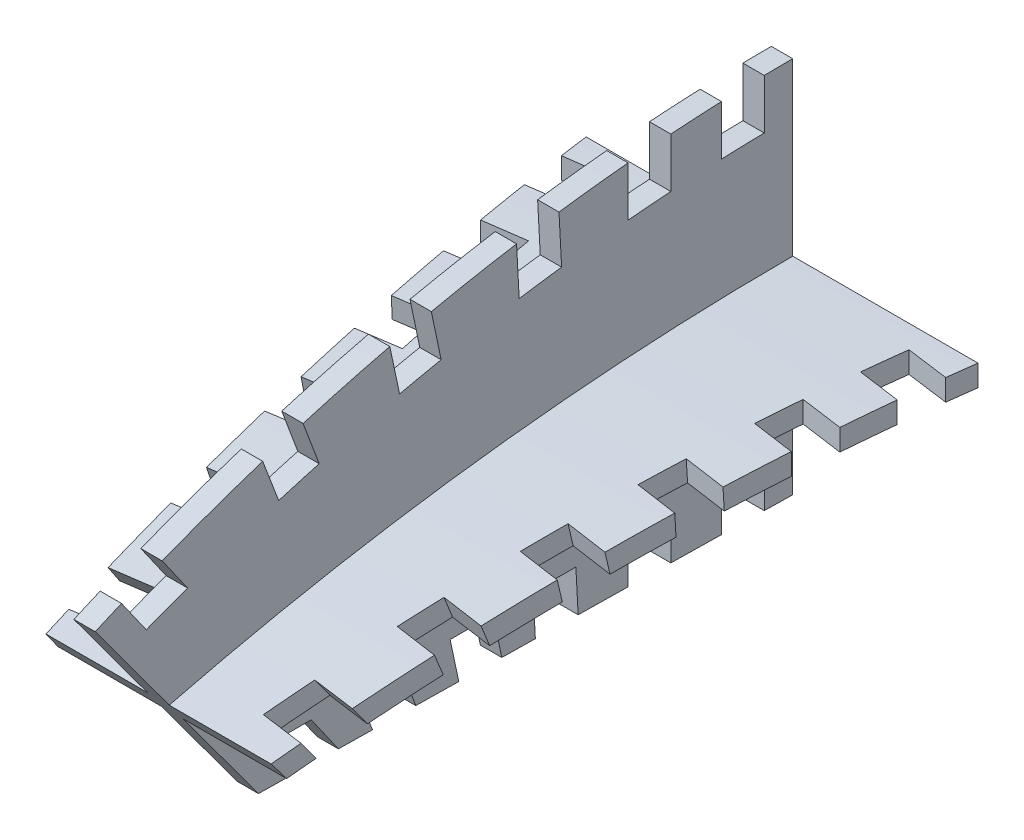
from build123d import *

# Parameters (mm, degrees)
CROQUIS4_OUTSIDE_W    = 187.146
CROQUIS4_OUTSIDE_H    = 118.564
CORTAR_EXTRUIR1_DEPTH = 80
CROQUIS6_OUTSIDE_W    = 81.834
CROQUIS6_OUTSIDE_H    = 124.727
CORTAR_EXTRUIR2_DEPTH = 160
CROQUIS7_W            = 6
CROQUIS7_H            = 11.530091944
CROQUIS7_H_2          = 11.150185128
CORTAR_EXTRUIR3_DEPTH = 80
CORTAR_EXTRUIR4_DEPTH = 6


with BuildPart() as part:
    # Barrer1: sweep along a path in Croquis1
    with BuildLine(Plane(origin=(0, 0, 0), x_dir=(0, 0, -1), z_dir=(1, 0, 0))) as barrer1_path:
        ThreePointArc((0, 0), (-70.78150519, -7.069828687), (-138.766305054, -27.999973026))
    # Croquis3 → Barrer1 (sweep)
    with BuildSketch(Plane.XY):
        Polygon((1.5, 1.5), (27.5, 1.5), (27.5, -1.5), (1.5, -1.5), (1.5, -27.5), (-1.5, -27.5), (-1.5, -1.5), (-27.5, -1.5), (-27.5, 1.5), (-1.5, 1.5), (-1.5, 27.5), (1.5, 27.5), align=None)
    sweep(path=barrer1_path.line)

    # Croquis4 outside → Cortar-Extruir1 (cut, symmetric)
    with BuildSketch(Plane(origin=(0, 0, 0), x_dir=(0, 0, -1), z_dir=(1, 0, 0))):
        with Locations((-74.715, -12.924)):
            Rectangle(CROQUIS4_OUTSIDE_W, CROQUIS4_OUTSIDE_H)
        with BuildLine():
            Line((0, -27.5), (-74.990890667, -26.331104364))
            Line((-74.990890667, -26.331104364), (-97.892548848, 4.795761137))
            ThreePointArc((-97.892548848, 4.795761137), (-50.029033138, 20.26731582), (0, 25.5))
            Line((0, 25.5), (0, -27.5))
        make_face(mode=Mode.SUBTRACT)
    extrude(amount=CORTAR_EXTRUIR1_DEPTH, both=True, mode=Mode.SUBTRACT)

    # Croquis6 outside → Cortar-Extruir2 (cut)
    with BuildSketch(Plane(origin=(0, 5.516683272, 0), x_dir=(1, 0, 0), z_dir=(0, 1, 0))):
        with Locations((0, -48.9465)):
            Rectangle(CROQUIS6_OUTSIDE_W, CROQUIS6_OUTSIDE_H)
        Polygon((-14, -100.938946435), (14, -100.938946435), (27.5, 0), (-27.5, 0), align=None, mode=Mode.SUBTRACT)
    extrude(amount=-CORTAR_EXTRUIR2_DEPTH, mode=Mode.SUBTRACT)

    # Croquis7 → Cortar-Extruir3 (cut, symmetric)
    with BuildSketch(Plane(origin=(0, 0, 0), x_dir=(0, 0, -1), z_dir=(1, 0, 0))):
        with BuildLine():
            Line((-39.162038985, 29.887130451), (-38.394773419, 15.534089498))
            ThreePointArc((-38.394773419, 15.534089498), (-35.420115181, 15.978111033), (-32.440330522, 16.386314579))
            Line((-32.440330522, 16.386314579), (-33.162038985, 29.887130451))
            Line((-33.162038985, 29.887130451), (-39.162038985, 29.887130451))
        make_face()
        with BuildLine():
            Line((-95.998773275, 8.949175928), (-90.73413022, 1.453466626))
            ThreePointArc((-90.73413022, 1.453466626), (-87.839590077, 2.560262358), (-84.931553052, 3.631093852))
            Line((-84.931553052, 3.631093852), (-91.088818329, 12.397703501))
            Line((-91.088818329, 12.397703501), (-95.998773275, 8.949175928))
        make_face()
        Polygon((-69.970419416, -28.109551905), (-62.557233475, -28.225082076), (-67.58991194, -21.059640015), (-74.921954778, -21.059640015), align=None)
        with BuildLine():
            Line((-23.107542671, 31.535166454), (-23.107542671, 17.429792254))
            ThreePointArc((-23.107542671, 17.429792254), (-20.109000001, 17.689943856), (-17.107542671, 17.913977122))
            Line((-17.107542671, 17.913977122), (-17.107542671, 31.535166454))
            Line((-17.107542671, 31.535166454), (-23.107542671, 31.535166454))
        make_face()
        with Locations((-20.107542671, -26.824685987)):
            Rectangle(CROQUIS7_W, CROQUIS7_H)
        with BuildLine():
            Line((-9.997867065, 30.351736416), (-9.997867065, 18.300005313))
            ThreePointArc((-9.997867065, 18.300005313), (-6.998371361, 18.402026399), (-3.997867065, 18.468032074))
            Line((-3.997867065, 18.468032074), (-3.997867065, 30.351736416))
            Line((-3.997867065, 30.351736416), (-9.997867065, 30.351736416))
        make_face()
        with Locations((-6.997867065, -26.634732579)):
            Rectangle(CROQUIS7_W, CROQUIS7_H_2)
        Polygon((-35.709124815, -34.705652912), (-29.709124815, -34.705652912), (-30.438595026, -21.059640015), (-36.438595026, -21.059640015), align=None)
        with BuildLine():
            Line((-78.122242186, 23.523224677), (-72.140898143, 7.865182964))
            ThreePointArc((-72.140898143, 7.865182964), (-69.306073667, 8.701307559), (-66.461562603, 9.503860335))
            Line((-66.461562603, 9.503860335), (-72.503742096, 25.628564731))
            Line((-72.503742096, 25.628564731), (-78.122242186, 23.523224677))
        make_face()
        Polygon((-56.752290541, -32.419317978), (-50.752290541, -32.419317978), (-55.008939937, -21.059640015), (-61.091667288, -21.059640015), align=None)
        with BuildLine():
            Line((-58.917927214, 29.946421194), (-55.176662948, 12.33505873))
            ThreePointArc((-55.176662948, 12.33505873), (-52.264623231, 12.975784401), (-49.345148973, 13.581733862))
            Line((-49.345148973, 13.581733862), (-53.046363557, 31.181224915))
            Line((-53.046363557, 31.181224915), (-58.917927214, 29.946421194))
        make_face()
        Polygon((-45.842434852, -31.60422559), (-39.842434852, -31.60422559), (-42.059986133, -21.059640015), (-48.082470585, -21.059640015), align=None)
    extrude(amount=CORTAR_EXTRUIR3_DEPTH, both=True, mode=Mode.SUBTRACT)

    # Croquis9 → Cortar-Extruir4 (cut)
    with BuildSketch(Plane(origin=(27.016737709, 0, 3.613332336), x_dir=(0.1325638496233049, 0, -0.9911744678779059), z_dir=(0.9911744678779059, 0, 0.1325638496233049))):
        Polygon((-87.893778079, 1.448550541), (-71.943159562, -21.061979807), (-64.496644077, -21.061979807), (-82.009325349, 3.653033146), align=None)
        Polygon((-69.155457281, 7.892041187), (-57.993411779, -21.061893746), (-51.949904083, -21.061893746), (-63.406420123, 9.519126463), align=None)
        Polygon((-52.033994421, 12.350105708), (-44.863809597, -21.185455498), (-38.763197845, -21.185455498), (-46.13783535, 13.582542059), align=None)
        Polygon((-35.090498628, 15.547528485), (-29.085076217, 16.400823069), (-27.058309382, -21.066127399), (-33.120994905, -21.066127399), align=None)
        Polygon((-19.668111949, 17.446776567), (-13.611801289, 17.961482645), (-13.611801289, -21.207767061), (-19.668111949, -21.207767061), align=None)
        Polygon((-6.442443224, 18.33084281), (-0.38885291, 18.529580975), (-0.38885291, -21.03436296), (-6.442443224, -21.233101125), align=None)
    cortar_extruir4 = extrude(amount=-CORTAR_EXTRUIR4_DEPTH, mode=Mode.SUBTRACT)

    # Simetría1: Cortar-Extruir4 across plane
    add(cortar_extruir4.mirror(Plane(origin=(0, 0, 0), x_dir=(0, 0, 1), z_dir=(1, 0, 0))), mode=Mode.SUBTRACT)


solid = part.part
